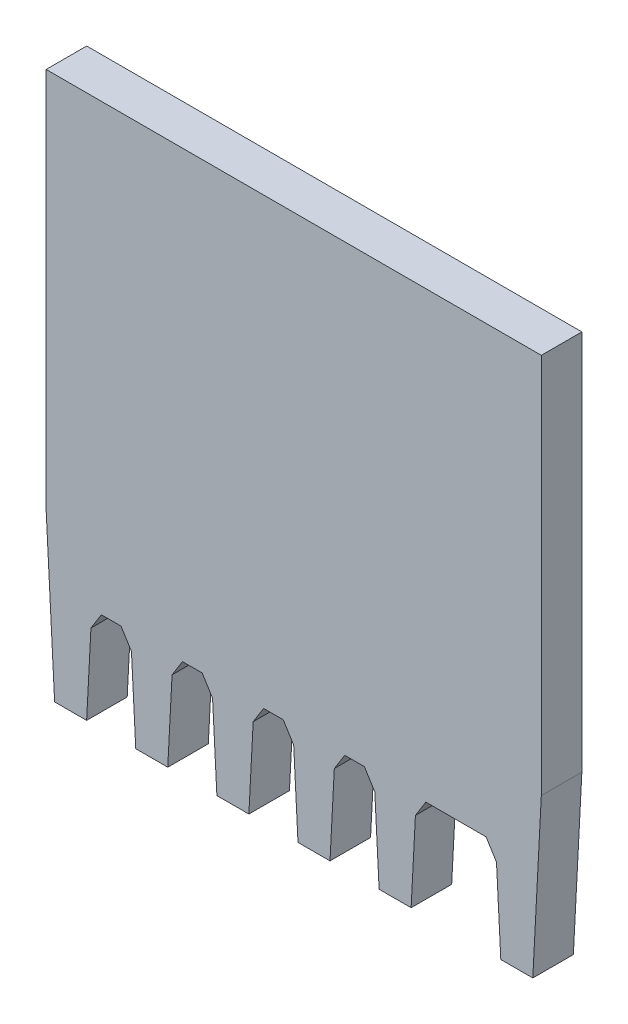
from build123d import *

# Parameters (mm, degrees)
BOSS_EXTRUDE1_DEPTH = 1.5


with BuildPart() as part:
    # Sketch1 → Boss-Extrude1 (new body)
    with BuildSketch(Plane.XY):
        Polygon((0, 6), (0.314446676, 0), (1.497941481, 0), (1.657221927, 3.039251967), (2.042586863, 3.65596478), (2.769801294, 3.65596478), (3.155166229, 3.039251967), (3.314446676, 0), (4.497941481, 0), (4.657221927, 3.039251967), (5.042586863, 3.65596478), (5.769801294, 3.65596478), (6.155166229, 3.039251967), (6.314446676, 0), (7.497941481, 0), (7.657221927, 3.039251967), (8.042586863, 3.65596478), (8.769801294, 3.65596478), (9.155166229, 3.039251967), (9.314446676, 0), (10.497941481, 0), (10.657221927, 3.039251967), (11.042586863, 3.65596478), (11.769801294, 3.65596478), (12.155166229, 3.039251967), (12.314446676, 0), (13.497941481, 0), (13.657221927, 3.039251967), (14.042586863, 3.65596478), (16.269801294, 3.65596478), (16.655166229, 3.039251967), (16.814446676, 0), (17.997941481, 0), (18.312388157, 6), (18.312388157, 20.1), (0, 20.1), align=None)
    extrude(amount=BOSS_EXTRUDE1_DEPTH)


solid = part.part
